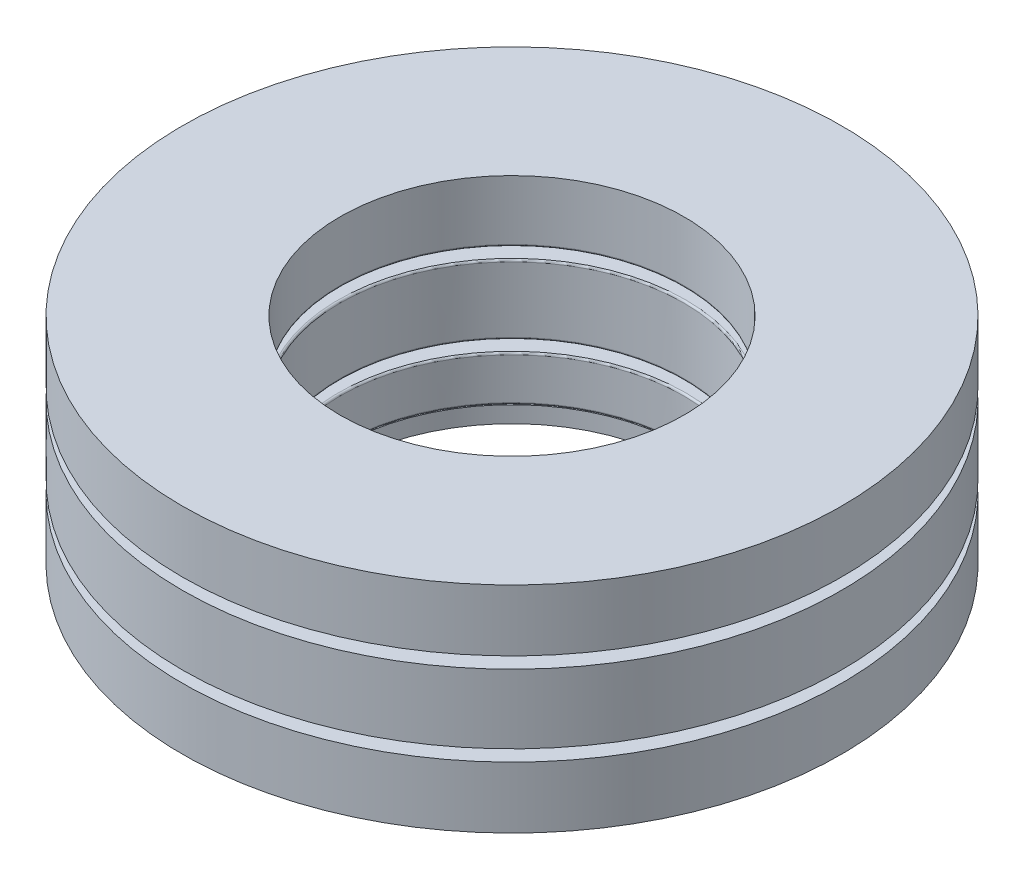
from build123d import *

# Parameters (mm, degrees)
SKETCH3_W                = 6
SKETCH3_H                = 2.4075
CIRPATTERN1_COUNT        = 8
CIRPATTERN1_ANGLE        = 315
CIRPATTERN2_COUNT        = 8
SKETCH6_W                = 6
SKETCH6_H                = 1.57
FILLET1_R                = 0.0635
FILLET2_R                = 0.0635
FILLET3_R                = 0.0635
CUT_EXTRUDE1_DEPTH       = 19.119671798
CUT_EXTRUDE1_DEPTH_BACK  = 19.119671798
SKETCH7_R                = 12.5
SKETCH7_R_2              = 11.5
BOSS_EXTRUDE1_DEPTH      = 0.575
BOSS_EXTRUDE1_DEPTH_BACK = 0.3
SKETCH8_R                = 11.5
SKETCH8_R_2              = 6
SKETCH9_R                = 11.5
SKETCH9_R_2              = 6
BOSS_EXTRUDE2_DEPTH      = 0.575


with BuildPart() as part:
    # Sketch3 → Revolve1 (revolve)
    with BuildSketch(Plane.XY):
        with Locations((9, 0)):
            Rectangle(SKETCH3_W, SKETCH3_H)
    revolve(axis=Axis((0, 3.175, 0), (0, -1, 0)))

    # Sketch4 → Cut-Revolve1 (revolve, cut)
    with BuildSketch(Plane.XY):
        with BuildLine():
            Line((9.15, 1.605), (9.15, -1.605))
            ThreePointArc((9.15, -1.605), (7.545, 0), (9.15, 1.605))
        make_face()
    cut_revolve1 = revolve(axis=Axis((9.15, 1.605, 0), (0, -1, 0)), mode=Mode.SUBTRACT)

    # CirPattern2: Cut-Revolve1 ×8 about axis
    cirpattern2_axis = Axis((0, 3.175, 0), (0, -1, 0))
    for i in range(1, CIRPATTERN2_COUNT):
        add(cut_revolve1.rotate(cirpattern2_axis, i * 360 / CIRPATTERN2_COUNT), mode=Mode.SUBTRACT)

    # Fillet2
    fillet2_edges = [part.edges().sort_by_distance(p)[0] for p in [
        (-6, -1.20375, 0),
        (-12, -1.20375, 0),
        (10.211607714, -1.20375, 0),
        (7.220697061, -1.20375, 7.220697061),
        (0, -1.20375, 10.211607714),
        (-7.220697061, -1.20375, 7.220697061),
        (-10.211607714, -1.20375, 0),
        (-7.220697061, -1.20375, -7.220697061),
        (0, -1.20375, -10.211607714),
        (-12, 1.20375, 0),
        (-6, 1.20375, 0),
        (10.211607714, 1.20375, 0),
        (7.220697061, 1.20375, 7.220697061),
        (0, 1.20375, 10.211607714),
        (-7.220697061, 1.20375, 7.220697061),
        (-10.211607714, 1.20375, 0),
        (-7.220697061, 1.20375, -7.220697061),
        (0, 1.20375, -10.211607714),
        (7.220697061, -1.20375, -7.220697061),
        (7.220697061, 1.20375, -7.220697061),
    ]]
    fillet(fillet2_edges, radius=FILLET2_R)


with BuildPart() as body_2:
    # Sketch5 → Revolve2 (revolve)
    with BuildSketch(Plane.XY):
        with BuildLine():
            Line((9.15, 1.605), (9.15, -1.605))
            ThreePointArc((9.15, -1.605), (7.545, 0), (9.15, 1.605))
        make_face()
    revolve(axis=Axis((9.15, 1.605, 0), (0, -1, 0)))


with BuildPart() as cirpattern1_1:
    # CirPattern1: pattern copy
    add(body_2.part.rotate(Axis((0, 3.175, 0), (0, -1, 0)), 1 * CIRPATTERN1_ANGLE / (CIRPATTERN1_COUNT - 1)))


with BuildPart() as cirpattern1_2:
    # CirPattern1: pattern copy
    add(body_2.part.rotate(Axis((0, 3.175, 0), (0, -1, 0)), 2 * CIRPATTERN1_ANGLE / (CIRPATTERN1_COUNT - 1)))


with BuildPart() as cirpattern1_3:
    # CirPattern1: pattern copy
    add(body_2.part.rotate(Axis((0, 3.175, 0), (0, -1, 0)), 3 * CIRPATTERN1_ANGLE / (CIRPATTERN1_COUNT - 1)))


with BuildPart() as cirpattern1_4:
    # CirPattern1: pattern copy
    add(body_2.part.rotate(Axis((0, 3.175, 0), (0, -1, 0)), 4 * CIRPATTERN1_ANGLE / (CIRPATTERN1_COUNT - 1)))


with BuildPart() as cirpattern1_5:
    # CirPattern1: pattern copy
    add(body_2.part.rotate(Axis((0, 3.175, 0), (0, -1, 0)), 5 * CIRPATTERN1_ANGLE / (CIRPATTERN1_COUNT - 1)))


with BuildPart() as cirpattern1_6:
    # CirPattern1: pattern copy
    add(body_2.part.rotate(Axis((0, 3.175, 0), (0, -1, 0)), 6 * CIRPATTERN1_ANGLE / (CIRPATTERN1_COUNT - 1)))


with BuildPart() as cirpattern1_7:
    # CirPattern1: pattern copy
    add(body_2.part.rotate(Axis((0, 3.175, 0), (0, -1, 0)), 7 * CIRPATTERN1_ANGLE / (CIRPATTERN1_COUNT - 1)))


with BuildPart() as body_10:
    # Sketch6 → Revolve3 (revolve)
    with BuildSketch(Plane.XY):
        with Locations((9, 2.39)):
            Rectangle(SKETCH6_W, SKETCH6_H)
        with Locations((9, -2.39)):
            Rectangle(SKETCH6_W, SKETCH6_H)
    revolve(axis=Axis((0, 3.175, 0), (0, -1, 0)))

    # Fillet1
    fillet1_edges = [body_10.edges().sort_by_distance(p)[0] for p in [
        (-6, 1.605, 0),
        (-12, 1.605, 0),
        (-12, 3.175, 0),
        (-6, 3.175, 0),
    ]]
    fillet(fillet1_edges, radius=FILLET1_R)

    # Fillet3
    fillet3_edges = [body_10.edges().sort_by_distance(p)[0] for p in [
        (-12, -1.605, 0),
        (-6, -1.605, 0),
        (-6, -3.175, 0),
        (-12, -3.175, 0),
    ]]
    fillet(fillet3_edges, radius=FILLET3_R)


with BuildPart() as cut_extrude1_tool:
    # Sketch7 → Cut-Extrude1 (new, two sides: drawn at the far end of the back side and taken through both)
    with BuildSketch(Plane(origin=(0, 3.175, 0), x_dir=(1, 0, 0), z_dir=(0, 1, 0)).offset(-CUT_EXTRUDE1_DEPTH_BACK)):
        Circle(SKETCH7_R)
        Circle(SKETCH7_R_2, mode=Mode.SUBTRACT)
    extrude(amount=CUT_EXTRUDE1_DEPTH + CUT_EXTRUDE1_DEPTH_BACK)


with BuildPart() as part_1:
    add(part.part)

    # Cut-Extrude1: cut by cut_extrude1_tool
    add(cut_extrude1_tool.part, mode=Mode.SUBTRACT)


with BuildPart() as body_10_1:
    add(body_10.part)

    # Cut-Extrude1: cut by cut_extrude1_tool
    add(cut_extrude1_tool.part, mode=Mode.SUBTRACT)

    # Sketch8 → Boss-Extrude1 (add, two sides: drawn at the far end of the back side and taken through both)
    with BuildSketch(Plane(origin=(0, 3.175, 0), x_dir=(1, 0, 0), z_dir=(0, 1, 0)).offset(-BOSS_EXTRUDE1_DEPTH_BACK)):
        Circle(SKETCH8_R)
        Circle(SKETCH8_R_2, mode=Mode.SUBTRACT)
    extrude(amount=BOSS_EXTRUDE1_DEPTH + BOSS_EXTRUDE1_DEPTH_BACK)

    # Sketch9 → Boss-Extrude2 (add)
    with BuildSketch(Plane.XZ.offset(3.175)):
        Circle(SKETCH9_R)
        Circle(SKETCH9_R_2, mode=Mode.SUBTRACT)
    extrude(amount=BOSS_EXTRUDE2_DEPTH)


solid = Compound([body_2.part, cirpattern1_1.part, cirpattern1_2.part, cirpattern1_3.part, cirpattern1_4.part, cirpattern1_5.part, cirpattern1_6.part, cirpattern1_7.part, part_1.part, body_10_1.part])
